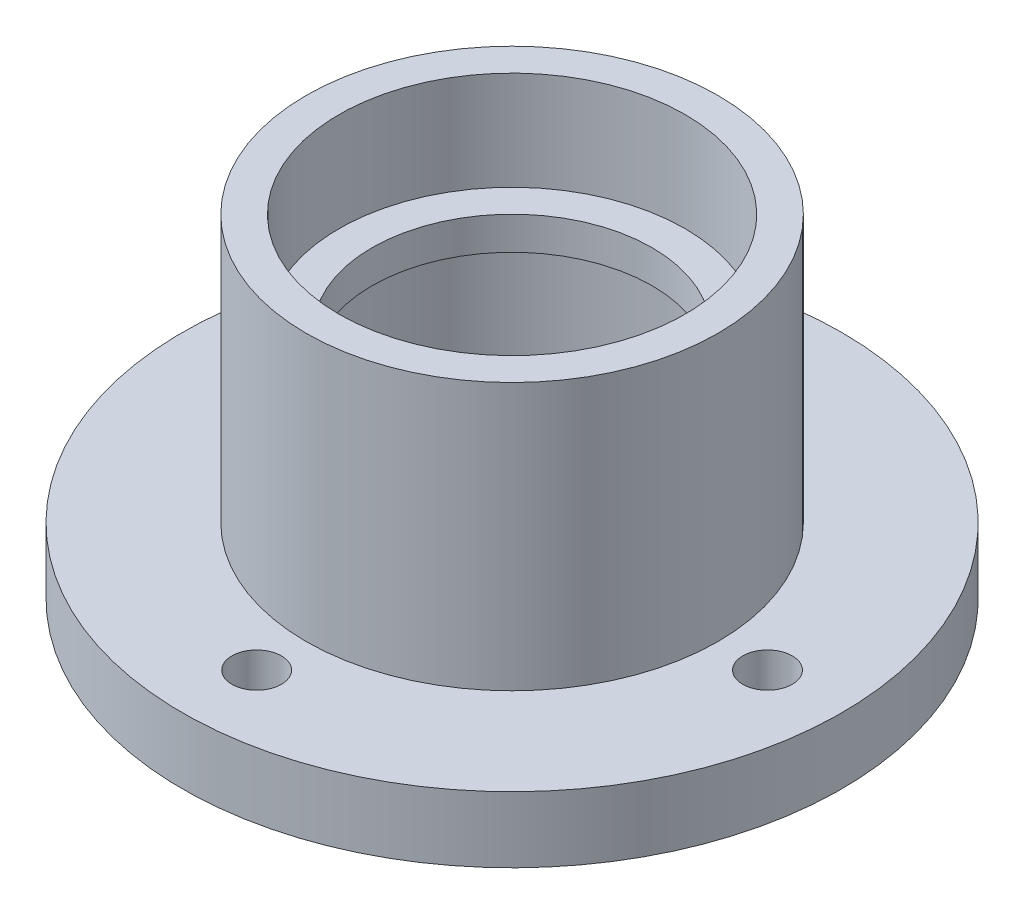
from build123d import *

# Parameters (mm, degrees)
SKETCH2_R          = 1.5
CUT_EXTRUDE1_DEPTH = 33.595091655


with BuildPart() as part:
    # Sketch1 → Revolve1 (revolve)
    with BuildSketch(Plane.XY):
        Polygon((-10.5, 20.2), (-10.5, 14.2), (-8.5, 14.2), (-8.5, 12.2), (-10.5, 12.2), (-10.5, 0), (-20, 0), (-20, 4), (-12.5, 4), (-12.5, 20.2), align=None)
    revolve(axis=Axis((0, 0, 0), (0, 1, 0)))

    # Sketch2 → Cut-Extrude1 (cut, through all)
    with BuildSketch(Plane(origin=(0, 4, 0), x_dir=(1, 0, 0), z_dir=(0, 1, 0))):
        with Locations((0, 15.5)):
            Circle(SKETCH2_R)
        with Locations((15.5, 0)):
            Circle(SKETCH2_R)
        with Locations((0, -15.5)):
            Circle(SKETCH2_R)
        with Locations((-15.5, 0)):
            Circle(SKETCH2_R)
    extrude(amount=-CUT_EXTRUDE1_DEPTH, mode=Mode.SUBTRACT)


solid = part.part
